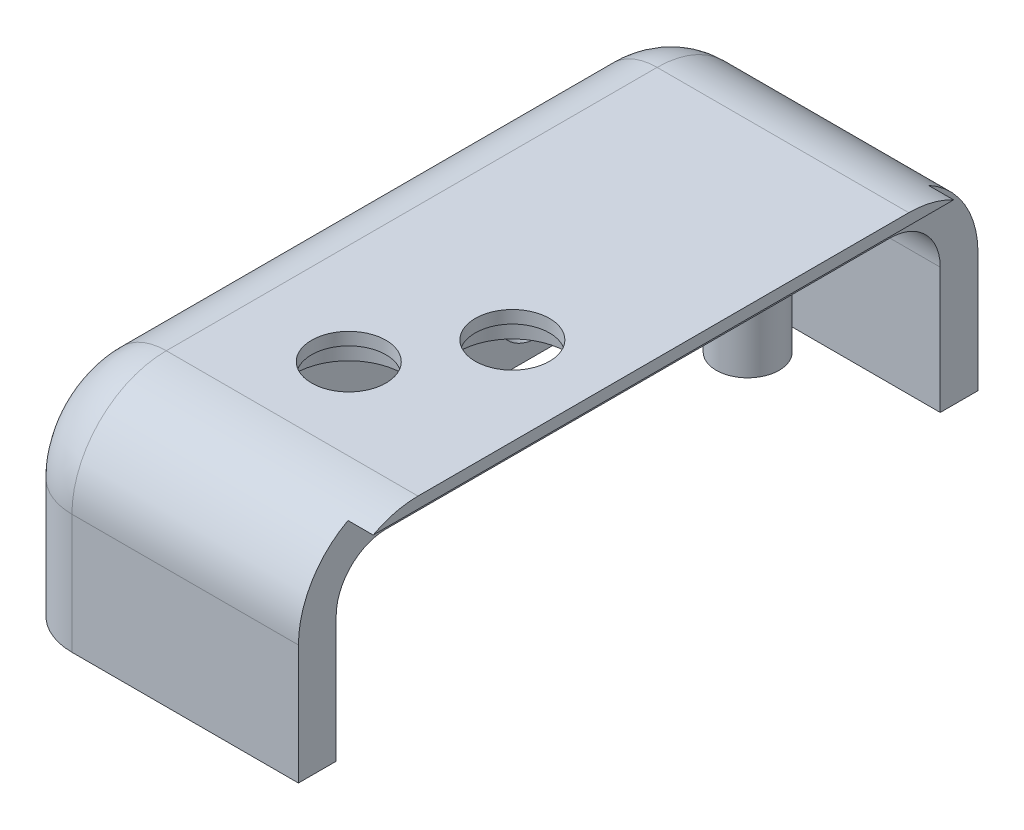
from build123d import *

# Parameters (mm, degrees)
SKETCH1_W           = 58.42
SKETCH1_H           = 137.16
BOSS_EXTRUDE1_DEPTH = 7.62
SKETCH2_R           = 6.35
SKETCH2_R_2         = 4.826
BOSS_EXTRUDE2_DEPTH = 35.56
BOSS_EXTRUDE3_DEPTH = 35.56
FILLET1_R           = 19.05
FILLET2_R           = 12.7
BOSS_EXTRUDE4_DEPTH = 5.08
SKETCH7_R           = 7.5
CUT_EXTRUDE1_DEPTH  = 158.192964219
CUT_EXTRUDE2_START  = -5.08
SKETCH8_R           = 11
SKETCH8_R_2         = 7.5
CUT_EXTRUDE2_DEPTH  = 5.08
FILLET3_R           = 10.16
CUT_EXTRUDE3_REACH  = 157.273
SKETCH9_R           = 8.5


with BuildPart() as part:
    # Sketch1 → Boss-Extrude1 (new body)
    with BuildSketch(Plane(origin=(0, 0, 0), x_dir=(1, 0, 0), z_dir=(0, 1, 0))):
        with Locations((29.21, 68.58)):
            Rectangle(SKETCH1_W, SKETCH1_H)
    extrude(amount=BOSS_EXTRUDE1_DEPTH)

    # Sketch2 → Boss-Extrude2 (add)
    # profile 1 of 2: a face of its own
    with BuildSketch(Plane.XZ):
        with Locations(Location((28.448, -120.65, 0), (0, 0, 270))):
            Circle(SKETCH2_R)
        with Locations(Location((28.448, -120.65, 0), (0, 0, 270))):
            Circle(SKETCH2_R_2, mode=Mode.SUBTRACT)
    # profile 2 of 2: a face of its own
    with BuildSketch(Plane.XZ):
        with Locations(Location((28.448, -15.24, 0), (0, 0, 270))):
            Circle(SKETCH2_R)
        with Locations(Location((28.448, -15.24, 0), (0, 0, 270))):
            Circle(SKETCH2_R_2, mode=Mode.SUBTRACT)
    extrude(amount=BOSS_EXTRUDE2_DEPTH)

    # Sketch3 → Boss-Extrude3 (add)
    with BuildSketch(Plane.XZ):
        Polygon((58.42, -137.16), (0, -137.16), (0, 0), (58.42, 0), (58.42, -7.62), (7.62, -7.62), (7.62, -129.54), (58.42, -129.54), align=None)
    extrude(amount=BOSS_EXTRUDE3_DEPTH)

    # Fillet1
    fillet1_edges = [part.edges().sort_by_distance(p)[0] for p in [
        (29.21, 7.62, -137.16),
        (29.21, 7.62, 0),
    ]]
    fillet(fillet1_edges, radius=FILLET1_R)

    # Fillet2
    fillet2_edges = [part.edges().sort_by_distance(p)[0] for p in [
        (0, 7.62, -68.58),
        (0, -23.495, 0),
        (0, -23.495, -137.16),
        (0, 2.040384182, -131.580384182),
        (0, 2.040384182, -5.579615818),
    ]]
    fillet(fillet2_edges, radius=FILLET2_R)

    # Sketch4 → Boss-Extrude4 (add)
    with BuildSketch(Plane(origin=(58.42, 0, 0), x_dir=(0, 0, -1), z_dir=(1, 0, 0))):
        with BuildLine():
            Line((10.00175133, 5.334), (127.15824867, 5.334))
            ThreePointArc((127.15824867, 5.334), (122.77627796, 7.039660257), (118.11, 7.62))
            Line((118.11, 7.62), (19.05, 7.62))
            ThreePointArc((19.05, 7.62), (14.38372204, 7.039660257), (10.00175133, 5.334))
        make_face()
    extrude(amount=BOSS_EXTRUDE4_DEPTH)

    # Sketch7 → Cut-Extrude1 (cut, through all)
    with BuildSketch(Plane(origin=(0, 7.62, 0), x_dir=(1, 0, 0), z_dir=(0, 1, 0))):
        with Locations(Location((45.72, 55.88, 0), (0, 0, 270))):
            Circle(SKETCH7_R)
        with Locations(Location((33.02, 35.56, 0), (0, 0, 270))):
            Circle(SKETCH7_R)
    extrude(amount=-CUT_EXTRUDE1_DEPTH, mode=Mode.SUBTRACT)

    # Sketch8 → Cut-Extrude2 (cut)
    # profile 1 of 2: a face of its own
    with BuildSketch(Plane.XZ.offset(CUT_EXTRUDE2_START)):
        with Locations(Location((45.72, -55.88, 0), (0, 0, 270))):
            Circle(SKETCH8_R)
        with Locations(Location((45.72, -55.88, 0), (0, 0, 90))):
            Circle(SKETCH8_R_2, mode=Mode.SUBTRACT)
    # profile 2 of 2: a face of its own
    with BuildSketch(Plane.XZ.offset(CUT_EXTRUDE2_START)):
        with Locations(Location((33.02, -35.56, 0), (0, 0, 270))):
            Circle(SKETCH8_R)
        with Locations(Location((33.02, -35.56, 0), (0, 0, 90))):
            Circle(SKETCH8_R_2, mode=Mode.SUBTRACT)
    extrude(amount=CUT_EXTRUDE2_DEPTH, mode=Mode.SUBTRACT)

    # Fillet3
    # the kernel refuses this fillet: 10.16 mm, written as the material it adds along each edge
    with BuildSketch(Plane(origin=(17.78, -10.16, -119.38), x_dir=(0, 1, 0), z_dir=(-1, 0, 0))) as fillet3_piece_1_section:
        Polygon((0, 0), (FILLET3_R * 1.02, 0), (FILLET3_R * 1.02, FILLET3_R * 1.02), (0, FILLET3_R * 1.02), align=None)
    fillet3_piece_1 = extrude(amount=FILLET3_R * 1.02, mode=Mode.PRIVATE)
    fillet3_piece_1 = fillet3_piece_1 - Plane(origin=(17.78, -10.16, -119.38), x_dir=(0, -0.7071067811865475, 0.7071067811865475), z_dir=(-1, 0, 0)) * Sphere(FILLET3_R, mode=Mode.PRIVATE)
    add(fillet3_piece_1)
    with BuildSketch(Plane(origin=(17.78, -10.16, -17.78), x_dir=(0, 0, 1), z_dir=(-1, 0, 0))) as fillet3_piece_2_section:
        Polygon((0, 0), (FILLET3_R * 1.02, 0), (FILLET3_R * 1.02, FILLET3_R * 1.02), (0, FILLET3_R * 1.02), align=None)
    fillet3_piece_2 = extrude(amount=FILLET3_R * 1.02, mode=Mode.PRIVATE)
    fillet3_piece_2 = fillet3_piece_2 - Plane(origin=(17.78, -10.16, -17.78), x_dir=(0, -0.7071067811865475, -0.7071067811865475), z_dir=(-1, 0, 0)) * Sphere(FILLET3_R, mode=Mode.PRIVATE)
    add(fillet3_piece_2)
    with BuildSketch(Plane(origin=(17.78, 0, -129.54), x_dir=(0, 0, 1), z_dir=(1, 0, 0))) as fillet3_piece_3_section:
        with BuildLine():
            CenterArc((FILLET3_R, FILLET3_R), FILLET3_R, 180, 90)
            Line((0, FILLET3_R), (0, 0))
            Line((0, 0), (FILLET3_R, 0))
        make_face()
    fillet3_piece_3 = extrude(amount=40.64, mode=Mode.PRIVATE)
    fillet3_piece_3 = fillet3_piece_3 - Plane(origin=(28.448, -2.379056343, -120.65), x_dir=(0, 0, -1), z_dir=(0, 1, 0)) * Cylinder(4.826, 122, mode=Mode.PRIVATE)
    add(fillet3_piece_3)
    with BuildSketch(Plane(origin=(7.62, 0, -17.78), x_dir=(1, 0, 0), z_dir=(0, 0, -1))) as fillet3_piece_4:
        with BuildLine():
            CenterArc((FILLET3_R, FILLET3_R), FILLET3_R, 180, 90)
            Line((0, FILLET3_R), (0, 0))
            Line((0, 0), (FILLET3_R, 0))
        make_face()
    extrude(amount=101.6)
    with BuildSketch(Plane(origin=(7.62, -10.16, -129.54), x_dir=(1, 0, 0), z_dir=(0, -1, 0))) as fillet3_piece_5:
        with BuildLine():
            CenterArc((FILLET3_R, FILLET3_R), FILLET3_R, 180, 90)
            Line((0, FILLET3_R), (0, 0))
            Line((0, 0), (FILLET3_R, 0))
        make_face()
    extrude(amount=25.4)
    with BuildSketch(Plane(origin=(58.42, 0, -7.62), x_dir=(0, -1, 0), z_dir=(-1, 0, 0))) as fillet3_piece_6_section:
        with BuildLine():
            CenterArc((FILLET3_R, -FILLET3_R), FILLET3_R, 90, 90)
            Line((0, -FILLET3_R), (0, 0))
            Line((0, 0), (FILLET3_R, 0))
        make_face()
    fillet3_piece_6 = extrude(amount=40.64, mode=Mode.PRIVATE)
    fillet3_piece_6 = fillet3_piece_6 - Plane(origin=(28.448, -2.418481563, -15.24), x_dir=(0, 0, -1), z_dir=(0, 1, 0)) * Cylinder(4.826, 122, mode=Mode.PRIVATE)
    add(fillet3_piece_6)
    with BuildSketch(Plane(origin=(7.62, -10.16, -7.62), x_dir=(1, 0, 0), z_dir=(0, -1, 0))) as fillet3_piece_7:
        with BuildLine():
            CenterArc((FILLET3_R, -FILLET3_R), FILLET3_R, 90, 90)
            Line((0, -FILLET3_R), (0, 0))
            Line((0, 0), (FILLET3_R, 0))
        make_face()
    extrude(amount=25.4)

    # Sketch9 → Cut-Extrude3 (cut, up to next)
    with BuildSketch(Plane.ZY, mode=Mode.PRIVATE) as cut_extrude3_sk1:
        with Locations((-99.06, -24.13)):
            Circle(SKETCH9_R)
    cut_extrude3_tool1 = extrude(cut_extrude3_sk1.sketch, amount=-CUT_EXTRUDE3_REACH, mode=Mode.PRIVATE) & part.part
    add(cut_extrude3_tool1.solids().sort_by_distance((0, -24.13, -99.06))[0], mode=Mode.SUBTRACT)


solid = part.part
